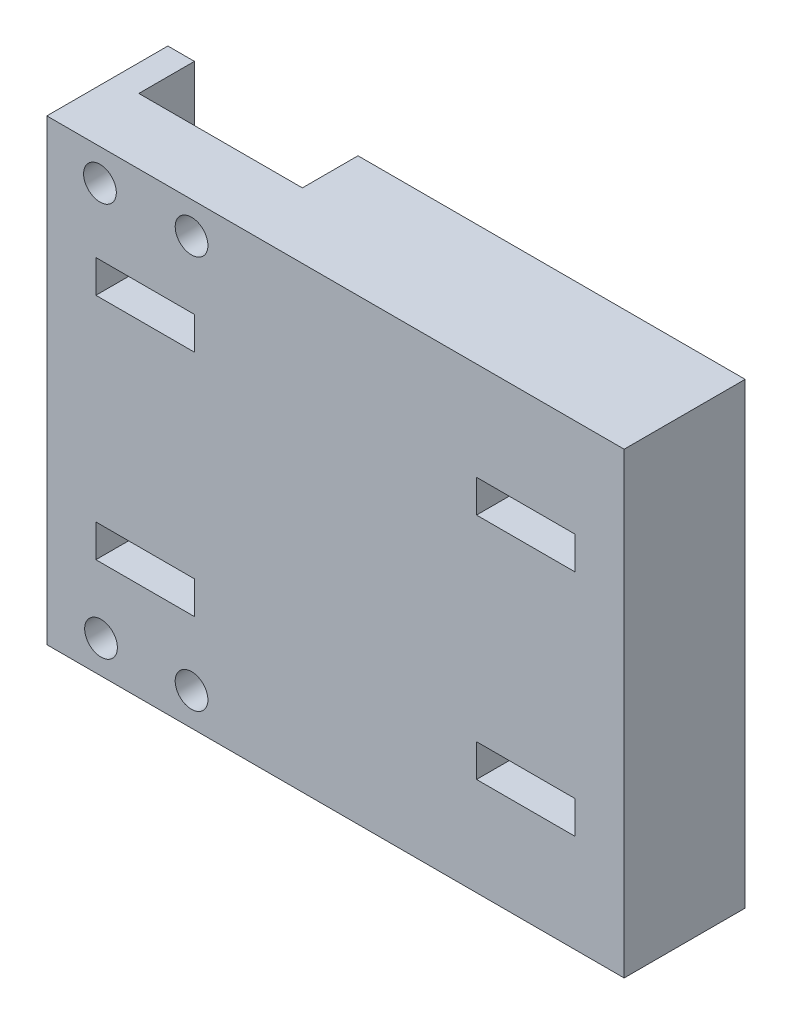
from build123d import *
from build123d.topology import SkipClean

# Parameters (mm, degrees)
SKETCH1_W                = 90
SKETCH1_H                = 70
SKETCH1_W_2              = 20.06126988
SKETCH1_H_2              = 45
SKETCH1_W_3              = 19.93873012
BOSS_EXTRUDE2_DEPTH      = 10
SKETCH1_W_4              = 15.06126988
SKETCH1_H_3              = 40
BOSS_EXTRUDE2_2_DEPTH    = 10
SKETCH1_W_5              = 14.93873012
BOSS_EXTRUDE2_3_DEPTH    = 10
SKETCH2_W                = 90
SKETCH2_H                = 70
BOSS_EXTRUDE3_DEPTH      = 10
SKETCH4_W                = 1.5
SKETCH4_H                = 70
CUT_EXTRUDE2_DEPTH       = 100.5
SKETCH10_W               = 5
SKETCH10_H               = 70
CUT_EXTRUDE4_DEPTH       = 100.5
SKETCH11_W               = 6.5
SKETCH11_H               = 5
CUT_EXTRUDE5_DEPTH       = 100.5
SKETCH12_W               = 18.5
SKETCH12_H               = 70
BOSS_EXTRUDE5_DEPTH      = 5
SKETCH13_W               = 18.5
SKETCH13_H               = 70
BOSS_EXTRUDE6_DEPTH      = 5
SKETCH14_W               = 40
SKETCH14_H               = 45
BOSS_EXTRUDE7_DEPTH      = 11
SKETCH15_R               = 2.5
CUT_EXTRUDE6_DEPTH       = 3
SKETCH16_W               = 30
SKETCH16_H               = 66
CUT_EXTRUDE8_DEPTH       = 15.5
SKETCH17_W               = 14.93873012
SKETCH17_H               = 15
SKETCH17_W_2             = 15.06126988
CUT_EXTRUDE10_DEPTH      = 10
SKETCH18_W               = 14.93873012
SKETCH18_H               = 5
SKETCH18_W_2             = 15.06126988
CUT_EXTRUDE11_DEPTH      = 10
CUT_EXTRUDE12_DEPTH      = 10
SKETCH23_W               = 14.93873012
SKETCH23_H               = 40
SKETCH23_W_2             = 5.3
SKETCH23_H_2             = 39
SKETCH23_W_3             = 2.93873012
SKETCH23_W_4             = 3.06126988
CUT_EXTRUDE14_DEPTH      = 10
SKETCH28_W               = 18.5
SKETCH28_H               = 44.033892013
CUT_EXTRUDE15_DEPTH      = 6
CUT_EXTRUDE16_DEPTH      = 75
SKETCH30_W               = 18.5
SKETCH30_H               = 44.033892013
BOSS_EXTRUDE9_DEPTH      = 6
SKETCH31_W               = 1
SKETCH31_H               = 1.413045359
BOSS_EXTRUDE10_DEPTH     = 11
SKETCH32_W               = 8.246560308
SKETCH32_H               = 43.371701703
BOSS_EXTRUDE11_DEPTH     = 5
SKETCH33_W               = 8.811569605
SKETCH33_H               = 37.919451222
BOSS_EXTRUDE12_DEPTH     = 5
SKETCH34_W               = 59.93873012
SKETCH34_H               = 70
CUT_EXTRUDE18_DEPTH      = 37
SKETCH35_W               = 14.36126988
SKETCH35_H               = 2
CUT_EXTRUDE20_DEPTH      = 7
SKETCH36_W               = 5.3
SKETCH36_H               = 2
CUT_EXTRUDE21_DEPTH      = 10
SKETCH37_W               = 14.36126988
SKETCH37_H               = 1.5
CUT_EXTRUDE22_DEPTH      = 10
SKETCH38_W               = 1.5
SKETCH38_H               = 4
CUT_EXTRUDE23_DEPTH      = 15
CUT_EXTRUDE24_DEPTH      = 10
CUT_EXTRUDE24_DEPTH_BACK = 6
SKETCH39_W               = 1.5
SKETCH39_H               = 2
CUT_EXTRUDE26_DEPTH      = 10
CUT_EXTRUDE26_DEPTH_BACK = 6
SKETCH41_W               = 16.397713906
SKETCH41_H               = 51.423830598
CUT_EXTRUDE27_DEPTH      = 5
BOSS_EXTRUDE13_DEPTH     = 14.37
FILLET4_R                = 1
BOSS_EXTRUDE14_DEPTH     = 14.37
FILLET5_R                = 1
CUT_EXTRUDE28_DEPTH      = 14.37
SKETCH45_W               = 14.36126988
SKETCH45_H               = 1
CUT_EXTRUDE29_DEPTH      = 14.37
SKETCH46_W               = 5
SKETCH46_H               = 51.423830598
BOSS_EXTRUDE15_DEPTH     = 18.37
SKETCH48_W               = 15.404975863
SKETCH48_H               = 48.247068862
CUT_EXTRUDE30_DEPTH      = 6
BOSS_EXTRUDE19_DEPTH     = 14.36
CUT_EXTRUDE33_DEPTH      = 15.36
CUT_EXTRUDE34_DEPTH      = 15.36
SKETCH56_W               = 3.76126988
SKETCH56_H               = 3.574209709
CUT_EXTRUDE35_DEPTH      = 5.36
BOSS_EXTRUDE23_DEPTH     = 14.36
CUT_EXTRUDE39_DEPTH      = 14.36
SKETCH61_W               = 0.148623377
SKETCH61_H               = 7.599329431
CUT_EXTRUDE41_DEPTH      = 10
CUT_EXTRUDE42_DEPTH      = 16
BOSS_EXTRUDE24_DEPTH     = 14.36
SKETCH68_W               = 15.06
SKETCH68_H               = 70
BOSS_EXTRUDE28_DEPTH     = 18.5
SKETCH70_W               = 6
SKETCH70_H               = 48.247068862
BOSS_EXTRUDE29_DEPTH     = 18.5
SKETCH72_W               = 16.06
SKETCH72_H               = 66
CUT_EXTRUDE44_DEPTH      = 16.5
SKETCH75_W               = 1
SKETCH75_H               = 70
CUT_EXTRUDE45_DEPTH      = 33.5
SKETCH76_R               = 2.5
CUT_EXTRUDE46_DEPTH      = 33.5
CUT_EXTRUDE48_DEPTH      = 26
CUT_EXTRUDE48_DEPTH_BACK = 23
SKETCH77_R               = 2.5
SKETCH78_W               = 22.535153564
SKETCH78_H               = 70
BOSS_EXTRUDE30_DEPTH     = 2
SKETCH79_W               = 35.12
SKETCH79_H               = 45
BOSS_EXTRUDE31_DEPTH     = 16.5
SKETCH80_W               = 6
SKETCH80_H               = 45
CUT_EXTRUDE49_DEPTH      = 16.5
SKETCH81_W               = 30.12
SKETCH81_H               = 66
BOSS_EXTRUDE33_DEPTH     = 16.5
SKETCH83_W               = 25
SKETCH83_H               = 10
CUT_EXTRUDE50_DEPTH      = 8.5
SKETCH84_R               = 2.5
CUT_EXTRUDE51_DEPTH      = 18.5


with BuildPart() as part:
    # Sketch1 → Boss-Extrude2 (new body)
    with BuildSketch(Plane.XY):
        with Locations((1.715542522, -5.667155425)):
            Rectangle(SKETCH1_W, SKETCH1_H)
        with Locations((-28.253822538, -5.667155425)):
            Rectangle(SKETCH1_W_2, SKETCH1_H_2, mode=Mode.SUBTRACT)
        with Locations((31.746177462, -5.667155425)):
            Rectangle(SKETCH1_W_3, SKETCH1_H_2, mode=Mode.SUBTRACT)
    extrude(amount=BOSS_EXTRUDE2_DEPTH)



with BuildPart() as body_2:
    # Sketch1 → Boss-Extrude2 2 (new body)
    with BuildSketch(Plane.XY):
        with Locations((-28.253822538, -5.667155425)):
            Rectangle(SKETCH1_W_4, SKETCH1_H_3)
    extrude(amount=BOSS_EXTRUDE2_2_DEPTH)


with BuildPart() as body_3:
    # Sketch1 → Boss-Extrude2 3 (new body)
    with BuildSketch(Plane.XY):
        with Locations((31.746177462, -5.667155425)):
            Rectangle(SKETCH1_W_5, SKETCH1_H_3)
    extrude(amount=BOSS_EXTRUDE2_3_DEPTH)


with BuildPart() as part_1:
    add(part.part)

    add(body_2.part)  # Boss-Extrude3 merges body 2

    add(body_3.part)  # Boss-Extrude3 merges body 3
    # Sketch2 → Boss-Extrude3 (add)
    with BuildSketch(Plane.XY.offset(10)):
        with Locations((1.715542522, -5.667155425)):
            Rectangle(SKETCH2_W, SKETCH2_H)
    extrude(amount=BOSS_EXTRUDE3_DEPTH)

    # Sketch4 → Cut-Extrude2 (cut)
    with BuildSketch(Plane.ZY.offset(43.284457478)):
        with Locations((19.25, -5.667155425)):
            Rectangle(SKETCH4_W, SKETCH4_H)
    extrude(amount=-CUT_EXTRUDE2_DEPTH, mode=Mode.SUBTRACT)

    # Sketch10 → Cut-Extrude4 (cut)
    with BuildSketch(Plane(origin=(0, 0, 0), x_dir=(-1, 0, 0), z_dir=(0, 0, -1))):
        with Locations((40.784457478, -5.667155425)):
            Rectangle(SKETCH10_W, SKETCH10_H)
        with Locations((-44.215542522, -5.667155425)):
            Rectangle(SKETCH10_W, SKETCH10_H)
    extrude(amount=-CUT_EXTRUDE4_DEPTH, mode=Mode.SUBTRACT)

    # Sketch11 → Cut-Extrude5 (cut)
    with BuildSketch(Plane.ZY.offset(35.784457478)):
        with Locations((6.75, 11.832844575)):
            Rectangle(SKETCH11_W, SKETCH11_H)
        Polygon((0, 9.332844575), (2, 14.332844575), (0, 14.332844575), align=None)
        Polygon((2, -25.667155425), (0, -20.667155425), (0, -25.667155425), align=None)
        with Locations((6.75, -23.167155425)):
            Rectangle(SKETCH11_W, SKETCH11_H)
    extrude(amount=-CUT_EXTRUDE5_DEPTH, mode=Mode.SUBTRACT)

    # Sketch12 → Boss-Extrude5 (add)
    with BuildSketch(Plane(origin=(41.715542522, 0, 0), x_dir=(0, 0, -1), z_dir=(1, 0, 0))):
        with Locations((-9.25, -5.667155425)):
            Rectangle(SKETCH12_W, SKETCH12_H)
    extrude(amount=BOSS_EXTRUDE5_DEPTH)

    # Sketch13 → Boss-Extrude6 (add)
    with BuildSketch(Plane.ZY.offset(38.284457478)):
        with Locations((9.25, -5.667155425)):
            Rectangle(SKETCH13_W, SKETCH13_H)
    extrude(amount=BOSS_EXTRUDE6_DEPTH)

    # Sketch14 → Boss-Extrude7 (add)
    with BuildSketch(Plane(origin=(0, 0, 0), x_dir=(-1, 0, 0), z_dir=(0, 0, -1))):
        with Locations((-1.776812402, -5.667155425)):
            Rectangle(SKETCH14_W, SKETCH14_H)
    extrude(amount=-BOSS_EXTRUDE7_DEPTH)

    # Sketch15 → Cut-Extrude6 (cut)
    with BuildSketch(Plane.XY.offset(18.5)):
        with Locations((8.715542522, 24.482844575)):
            Circle(SKETCH15_R)
        with Locations((-5.284457478, 24.482844575)):
            Circle(SKETCH15_R)
        with Locations((1.715542522, -35.667155425)):
            Circle(SKETCH15_R)
    extrude(amount=-CUT_EXTRUDE6_DEPTH, mode=Mode.SUBTRACT)

    # Sketch16 → Cut-Extrude8 (cut)
    with BuildSketch(Plane(origin=(0, 0, 0), x_dir=(-1, 0, 0), z_dir=(0, 0, -1))):
        with Locations((-1.776812402, -5.667155425)):
            Rectangle(SKETCH16_W, SKETCH16_H)
    extrude(amount=-CUT_EXTRUDE8_DEPTH, mode=Mode.SUBTRACT)

    # Sketch17 → Cut-Extrude10 (cut)
    with BuildSketch(Plane(origin=(0, 0, 0), x_dir=(-1, 0, 0), z_dir=(0, 0, -1))):
        with Locations((-31.746177462, -5.667155425)):
            Rectangle(SKETCH17_W, SKETCH17_H)
        with Locations((28.253822538, -5.667155425)):
            Rectangle(SKETCH17_W_2, SKETCH17_H)
    extrude(amount=-CUT_EXTRUDE10_DEPTH, mode=Mode.SUBTRACT)

    # Sketch18 → Cut-Extrude11 (cut)
    with BuildSketch(Plane(origin=(0, 0, 10), x_dir=(-1, 0, 0), z_dir=(0, 0, -1))):
        with Locations((-31.746177462, 11.832844575)):
            Rectangle(SKETCH18_W, SKETCH18_H)
        with Locations((-31.746177462, -23.167155425)):
            Rectangle(SKETCH18_W, SKETCH18_H)
        with Locations((28.253822538, -23.167155425)):
            Rectangle(SKETCH18_W_2, SKETCH18_H)
        with Locations((28.253822538, 11.832844575)):
            Rectangle(SKETCH18_W_2, SKETCH18_H)
    extrude(amount=-CUT_EXTRUDE11_DEPTH, mode=Mode.SUBTRACT)

    # Sketch19 → Cut-Extrude12 (cut)
    with BuildSketch(Plane(origin=(0, 0, 0), x_dir=(-1, 0, 0), z_dir=(0, 0, -1))):
        Polygon((-30.276812402, 14.332844575), (-33.215542522, 14.332844575), (-33.215542522, 4.832844575), (-39.215542522, 4.832844575), (-39.215542522, 1.832844575), (-24.276812402, 1.832844575), (-24.276812402, 4.832844575), (-30.276812402, 4.832844575), align=None)
        Polygon((20.723187598, 4.832844575), (20.723187598, 1.832844575), (35.784457478, 1.832844575), (35.784457478, 4.832844575), (29.784457478, 4.832844575), (29.784457478, 14.332844575), (26.723187598, 14.332844575), (26.723187598, 4.832844575), align=None)
        Polygon((20.723187598, -13.167155425), (20.723187598, -16.167155425), (26.723187598, -16.167155425), (26.723187598, -25.667155425), (29.784457478, -25.667155425), (29.784457478, -16.167155425), (35.784457478, -16.167155425), (35.784457478, -13.167155425), align=None)
        Polygon((-39.215542522, -13.167155425), (-39.215542522, -16.167155425), (-33.215542522, -16.167155425), (-33.215542522, -25.667155425), (-30.276812402, -25.667155425), (-30.276812402, -16.167155425), (-24.276812402, -16.167155425), (-24.276812402, -13.167155425), align=None)
    extrude(amount=-CUT_EXTRUDE12_DEPTH, mode=Mode.SUBTRACT)

    # Sketch23 → Cut-Extrude14 (cut)
    # profile 1 of 2: a face of its own
    with BuildSketch(Plane(origin=(0, 0, 0), x_dir=(-1, 0, 0), z_dir=(0, 0, -1))):
        with Locations((-31.746177462, -5.667155425)):
            Rectangle(SKETCH23_W, SKETCH23_H)
        with Locations((-36.215542522, -5.667155425)):
            Rectangle(SKETCH23_W_2, SKETCH23_H_2, mode=Mode.SUBTRACT)
        with Locations((-31.746177462, -5.667155425)):
            Rectangle(SKETCH23_W_3, SKETCH23_H_2, mode=Mode.SUBTRACT)
        with Locations((-27.276812402, -5.667155425)):
            Rectangle(SKETCH23_W_2, SKETCH23_H_2, mode=Mode.SUBTRACT)
    # profile 2 of 2: a face of its own
    with BuildSketch(Plane(origin=(0, 0, 0), x_dir=(-1, 0, 0), z_dir=(0, 0, -1))):
        Polygon((20.723187598, 13.832844575), (20.723187598, -25.667155425), (35.784457478, -25.667155425), (35.784457478, 14.332844575), (20.723187598, 14.332844575), align=None)
        with Locations((23.723187598, -5.667155425)):
            Rectangle(SKETCH23_W_2, SKETCH23_H_2, mode=Mode.SUBTRACT)
        with Locations((28.253822538, -5.667155425)):
            Rectangle(SKETCH23_W_4, SKETCH23_H_2, mode=Mode.SUBTRACT)
        with Locations((32.784457478, -5.667155425)):
            Rectangle(SKETCH23_W_2, SKETCH23_H_2, mode=Mode.SUBTRACT)
    extrude(amount=-CUT_EXTRUDE14_DEPTH, mode=Mode.SUBTRACT)

    # Sketch28 → Cut-Extrude15 (cut)
    with BuildSketch(Plane(origin=(46.715542522, 0, 0), x_dir=(0, 0, -1), z_dir=(1, 0, 0))):
        with Locations((-9.25, -5.184101432)):
            Rectangle(SKETCH28_W, SKETCH28_H)
    extrude(amount=-CUT_EXTRUDE15_DEPTH, mode=Mode.SUBTRACT)

    # Sketch29 → Cut-Extrude16 (cut)
    with BuildSketch(Plane(origin=(38.865542522, 0, 0), x_dir=(0, 0, -1), z_dir=(1, 0, 0))):
        Polygon((-3.5, 9.332844575), (-3.5, 7.724451309), (-5, 7.536386318), (-10, 8.528647942), (-10, 9.332844575), align=None)
        Polygon((-10, -19.862958792), (-10, -20.667155425), (-3.5, -20.667155425), (-3.5, -19.058762159), (-5, -18.870697169), align=None)
    extrude(amount=-CUT_EXTRUDE16_DEPTH, mode=Mode.SUBTRACT)

    # Sketch30 → Boss-Extrude9 (add)
    with BuildSketch(Plane(origin=(46.715542522, 0, 0), x_dir=(0, 0, -1), z_dir=(1, 0, 0))):
        with Locations((-9.25, -5.184101432)):
            Rectangle(SKETCH30_W, SKETCH30_H)
    extrude(amount=-BOSS_EXTRUDE9_DEPTH)

    # Sketch31 → Boss-Extrude10 (add)
    with BuildSketch(Plane(origin=(0, 0, 0), x_dir=(-1, 0, 0), z_dir=(0, 0, -1))):
        with Locations((-41.215542522, -27.907570118)):
            Rectangle(SKETCH31_W, SKETCH31_H)
    extrude(amount=-BOSS_EXTRUDE10_DEPTH)

    # Sketch32 → Boss-Extrude11 (add)
    with BuildSketch(Plane(origin=(21.776812402, 0, 0), x_dir=(0, 0, -1), z_dir=(1, 0, 0))):
        with Locations((-5.876719846, -6.481304574)):
            Rectangle(SKETCH32_W, SKETCH32_H)
    extrude(amount=-BOSS_EXTRUDE11_DEPTH)

    # Sketch33 → Boss-Extrude12 (add)
    with BuildSketch(Plane(origin=(-13.223187598, 0, 0), x_dir=(0, 0, -1), z_dir=(1, 0, 0))):
        with Locations((-7.016962477, -6.558213026)):
            Rectangle(SKETCH33_W, SKETCH33_H)
    extrude(amount=-BOSS_EXTRUDE12_DEPTH)

    # Sketch34 → Cut-Extrude18 (cut)
    with BuildSketch(Plane(origin=(0, 0, 0), x_dir=(-1, 0, 0), z_dir=(0, 0, -1))):
        with Locations((-16.746177462, -5.667155425)):
            Rectangle(SKETCH34_W, SKETCH34_H)
    extrude(amount=-CUT_EXTRUDE18_DEPTH, mode=Mode.SUBTRACT)

    # Sketch35 → Cut-Extrude20 (cut)
    with BuildSketch(Plane(origin=(0, 0, 0), x_dir=(-1, 0, 0), z_dir=(0, 0, -1))):
        with Locations((28.253822538, 12.832844575)):
            Rectangle(SKETCH35_W, SKETCH35_H)
    extrude(amount=-CUT_EXTRUDE20_DEPTH, mode=Mode.SUBTRACT)

    # Sketch36 → Cut-Extrude21 (cut)
    with BuildSketch(Plane(origin=(0, 0, 0), x_dir=(-1, 0, 0), z_dir=(0, 0, -1))):
        with Locations((23.723187598, 5.832844575)):
            Rectangle(SKETCH36_W, SKETCH36_H)
        with Locations((32.784457478, 5.832844575)):
            Rectangle(SKETCH36_W, SKETCH36_H)
    extrude(amount=-CUT_EXTRUDE21_DEPTH, mode=Mode.SUBTRACT)

    # Sketch37 → Cut-Extrude22 (cut)
    with BuildSketch(Plane(origin=(0, 0, 0), x_dir=(-1, 0, 0), z_dir=(0, 0, -1))):
        with Locations((28.253822538, -16.917155425)):
            Rectangle(SKETCH37_W, SKETCH37_H)
    extrude(amount=-CUT_EXTRUDE22_DEPTH, mode=Mode.SUBTRACT)

    # Sketch38 → Cut-Extrude23 (cut)
    with BuildSketch(Plane(origin=(-21.073187598, 0, 0), x_dir=(0, 0, -1), z_dir=(1, 0, 0))):
        with Locations((-2.75, 9.832844575)):
            Rectangle(SKETCH38_W, SKETCH38_H)
    extrude(amount=-CUT_EXTRUDE23_DEPTH, mode=Mode.SUBTRACT)

    # Sketch39 → Cut-Extrude24 (cut, two sides: drawn at the far end of the back side and taken through both)
    with BuildSketch(Plane(origin=(-30.134457478, 0, 0), x_dir=(0, 0, -1), z_dir=(1, 0, 0)).offset(-CUT_EXTRUDE24_DEPTH_BACK)):
        with Locations((-2.75, -20.058762159)):
            Rectangle(SKETCH39_W, SKETCH39_H)
    extrude(amount=CUT_EXTRUDE24_DEPTH + CUT_EXTRUDE24_DEPTH_BACK, mode=Mode.SUBTRACT)

    # Sketch40 → Cut-Extrude26 (cut, two sides: drawn at the far end of the back side and taken through both)
    with BuildSketch(Plane.ZY.offset(26.373187598).offset(-CUT_EXTRUDE26_DEPTH_BACK)):
        Polygon((2, -21.058762159), (3.5, -22.496291026), (3.5, -21.058762159), align=None)
    extrude(amount=CUT_EXTRUDE26_DEPTH + CUT_EXTRUDE26_DEPTH_BACK, mode=Mode.SUBTRACT)

    # Sketch41 → Cut-Extrude27 (cut)
    with BuildSketch(Plane.ZY.offset(43.284457478)):
        with Locations((8.198856953, -6.213161349)):
            Rectangle(SKETCH41_W, SKETCH41_H)
    extrude(amount=-CUT_EXTRUDE27_DEPTH, mode=Mode.SUBTRACT)

    # Sketch42 → Boss-Extrude13 (add)
    with BuildSketch(Plane.ZY.offset(35.434457478)):
        Polygon((10, 8.528647942), (2, 7.832844575), (2, 6.832844575), (10, 6.832844575), align=None)
    extrude(amount=-BOSS_EXTRUDE13_DEPTH)

    # Fillet4
    fillet4_edges = [part_1.edges().sort_by_distance(p)[0] for p in [
        (-23.723187598, 7.832844575, 2),
        (-32.784457478, 7.832844575, 2),
    ]]
    fillet(fillet4_edges, radius=FILLET4_R)

    # Sketch43 → Boss-Extrude14 (add)
    with BuildSketch(Plane.ZY.offset(35.434457478)):
        Polygon((10, -17.667155425), (10, -19.862958792), (2, -19.058762159), (2, -17.667155425), align=None)
    extrude(amount=-BOSS_EXTRUDE14_DEPTH)

    # Fillet5
    fillet5_edges = [part_1.edges().sort_by_distance(p)[0] for p in [
        (-23.723187598, -19.058762159, 2),
        (-32.784457478, -19.058762159, 2),
    ]]
    fillet(fillet5_edges, radius=FILLET5_R)

    # Sketch44 → Cut-Extrude28 (cut)
    with BuildSketch(Plane.ZY.offset(35.434457478)):
        Polygon((3.5, -25.167155425), (2.65, -25.167155425), (2.75, -21.777526593), (3.5, -22.496291026), align=None)
    extrude(amount=-CUT_EXTRUDE28_DEPTH, mode=Mode.SUBTRACT)

    # Sketch45 → Cut-Extrude29 (cut)
    with BuildSketch(Plane(origin=(0, 0, 0), x_dir=(-1, 0, 0), z_dir=(0, 0, -1))):
        with Locations((28.253822538, -24.667155425)):
            Rectangle(SKETCH45_W, SKETCH45_H)
    extrude(amount=-CUT_EXTRUDE29_DEPTH, mode=Mode.SUBTRACT)

    # Sketch46 → Boss-Extrude15 (add)
    with BuildSketch(Plane(origin=(0, 0, 0), x_dir=(-1, 0, 0), z_dir=(0, 0, -1))):
        with Locations((40.784457478, -6.213161349)):
            Rectangle(SKETCH46_W, SKETCH46_H)
    extrude(amount=-BOSS_EXTRUDE15_DEPTH)

    # Sketch48 → Cut-Extrude30 (cut)
    with BuildSketch(Plane.ZY.offset(43.284457478)):
        with Locations((7.702487932, -6.312435153)):
            Rectangle(SKETCH48_W, SKETCH48_H)
    extrude(amount=-CUT_EXTRUDE30_DEPTH, mode=Mode.SUBTRACT)

    # Sketch52 → Boss-Extrude19 (add)
    with BuildSketch(Plane.ZY.offset(35.434457478)):
        with BuildLine():
            Line((10, 8.528647942), (3.782211541, 7.987853174))
            ThreePointArc((3.782211541, 7.987853174), (2.993551961, 8.279394923), (2.717099882, 9.073469714))
            Line((2.717099882, 9.073469714), (2.717099882, 11.832427917))
            Line((2.717099882, 11.832427917), (1.5, 11.832844575))
            Line((1.5, 11.832844575), (0, 8.279394923))
            Line((0, 8.279394923), (0, 5.979658876))
            Line((0, 5.979658876), (10, 5.979658876))
            Line((10, 5.979658876), (10, 8.528647942))
        make_face()
    extrude(amount=-BOSS_EXTRUDE19_DEPTH)

    # Sketch53 → Cut-Extrude33 (cut)
    with BuildSketch(Plane.ZY.offset(35.434457478)):
        Polygon((0, 9.332844575), (0.5, 9.332844575), (1.5, 11.832844575), (1, 11.832844575), align=None)
    extrude(amount=-CUT_EXTRUDE33_DEPTH, mode=Mode.SUBTRACT)

    # Sketch55 → Cut-Extrude34 (cut)
    with BuildSketch(Plane.ZY.offset(35.434457478)):
        Polygon((0.5, 9.332844575), (0, 8.258634866), (0, 9.332844575), align=None)
    extrude(amount=-CUT_EXTRUDE34_DEPTH, mode=Mode.SUBTRACT)

    # Sketch56 → Cut-Extrude35 (cut)
    with BuildSketch(Plane(origin=(0, 0, 0), x_dir=(-1, 0, 0), z_dir=(0, 0, -1))):
        with Locations((28.253822538, 10.045739721)):
            Rectangle(SKETCH56_W, SKETCH56_H)
    extrude(amount=-CUT_EXTRUDE35_DEPTH, mode=Mode.SUBTRACT)

    # Sketch58 → Boss-Extrude23 (add)
    with BuildSketch(Plane.ZY.offset(35.434457478)):
        Polygon((1.5, 11.832844575), (2.146438787, 13.448941543), (2.736734348, 13.448941543), (2.717099882, 11.832427917), align=None)
    extrude(amount=-BOSS_EXTRUDE23_DEPTH)

    # Sketch59 → Cut-Extrude39 (cut)
    with BuildSketch(Plane(origin=(0, 0, 0), x_dir=(-1, 0, 0), z_dir=(0, 0, -1))):
        Polygon((26.373187598, 13.448941543), (26.373187598, 11.832844575), (26.373187598, 11.431091881), (30.134457478, 11.431091881), (30.134457478, 11.832844575), (30.134457478, 13.448941543), (30.134457478, 13.829263242), (26.373187598, 13.829263242), align=None)
    extrude(amount=-CUT_EXTRUDE39_DEPTH, mode=Mode.SUBTRACT)

    # Sketch61 → Cut-Extrude41 (cut)
    with BuildSketch(Plane(origin=(0, 0, 0), x_dir=(-1, 0, 0), z_dir=(0, 0, -1))):
        with Locations((21.00014579, 9.779323592)):
            Rectangle(SKETCH61_W, SKETCH61_H)
    extrude(amount=-CUT_EXTRUDE41_DEPTH, mode=Mode.SUBTRACT)

    # Sketch62 → Cut-Extrude42 (cut)
    with BuildSketch(Plane.ZY.offset(35.434457478)):
        Polygon((10, -17.667155425), (0, -17.667155425), (0, -20.667155425), (1.4, -24.167155425), (2.679501755, -24.167155425), (2.75, -21.777526593), (10, -19.862958792), align=None)
    extrude(amount=-CUT_EXTRUDE42_DEPTH, mode=Mode.SUBTRACT)

    # Sketch65 → Boss-Extrude24 (add)
    with BuildSketch(Plane.ZY.offset(35.434457478)):
        with BuildLine():
            Line((0, 8.258634866), (0, 5.979658876))
            Line((0, 5.979658876), (10, 5.979658876))
            Line((10, 5.979658876), (10, 8.528647942))
            Line((10, 8.528647942), (3.782211541, 7.987853174))
            ThreePointArc((3.782211541, 7.987853174), (3.026420054, 8.311642211), (2.717099882, 9.073469714))
            Line((2.717099882, 9.073469714), (2.736734348, 13.448941543))
            Line((2.736734348, 13.448941543), (2.146438787, 13.448941543))
            Line((2.146438787, 13.448941543), (0.5, 9.332844575))
            Line((0.5, 9.332844575), (0, 8.258634866))
        make_face()
        with BuildLine():
            Line((10, -17.313969726), (10, -19.862958792))
            Line((10, -19.862958792), (3.782211541, -19.322164024))
            ThreePointArc((3.782211541, -19.322164024), (3.026420054, -19.645953062), (2.717099882, -20.407780564))
            Line((2.717099882, -20.407780564), (2.736734348, -24.783252393))
            Line((2.736734348, -24.783252393), (2.146438787, -24.783252393))
            Line((2.146438787, -24.783252393), (0.5, -20.667155425))
            Line((0.5, -20.667155425), (0, -19.592945716))
            Line((0, -19.592945716), (0, -17.313969726))
            Line((0, -17.313969726), (10, -17.313969726))
        make_face()
    extrude(amount=-BOSS_EXTRUDE24_DEPTH)

    # Sketch68 → Boss-Extrude28 (add)
    with BuildSketch(Plane(origin=(0, 0, 0), x_dir=(-1, 0, 0), z_dir=(0, 0, -1))):
        with Locations((50.814457478, -5.667155425)):
            Rectangle(SKETCH68_W, SKETCH68_H)
    extrude(amount=-BOSS_EXTRUDE28_DEPTH)

    # Sketch70 → Boss-Extrude29 (add)
    with BuildSketch(Plane(origin=(0, 0, 0), x_dir=(-1, 0, 0), z_dir=(0, 0, -1))):
        with Locations((40.284457478, -6.312435153)):
            Rectangle(SKETCH70_W, SKETCH70_H)
    extrude(amount=-BOSS_EXTRUDE29_DEPTH)

    # Sketch72 → Cut-Extrude44 (cut)
    with BuildSketch(Plane(origin=(0, 0, 0), x_dir=(-1, 0, 0), z_dir=(0, 0, -1))):
        with Locations((50.314457478, -5.667155425)):
            Rectangle(SKETCH72_W, SKETCH72_H)
    extrude(amount=-CUT_EXTRUDE44_DEPTH, mode=Mode.SUBTRACT)

    # Sketch75 → Cut-Extrude45 (cut)
    with BuildSketch(Plane(origin=(0, 0, 0), x_dir=(-1, 0, 0), z_dir=(0, 0, -1))):
        with Locations((57.844457478, -5.667155425)):
            Rectangle(SKETCH75_W, SKETCH75_H)
    extrude(amount=-CUT_EXTRUDE45_DEPTH, mode=Mode.SUBTRACT)

    # Sketch76 → Cut-Extrude46 (cut)
    with BuildSketch(Plane(origin=(0, 0, 16.5), x_dir=(-1, 0, 0), z_dir=(0, 0, -1))):
        with Locations((50.344457478, 24.482844575)):
            Circle(SKETCH76_R)
        with Locations((57.344457478, -35.667155425)):
            Circle(SKETCH76_R)
    extrude(amount=-CUT_EXTRUDE46_DEPTH, mode=Mode.SUBTRACT)

    # Mirror15: part across plane


with BuildPart() as part_2:
    with SkipClean():  # the faces are left unmerged after this step: merging them gives an invalid solid
        add(part_1.part)
        add(part_1.part.mirror(Plane(origin=(-57.344457478, -40.667155425, 33.5), x_dir=(0, 0, 1), z_dir=(1, 0, 0))))

    # Sketch77 → Cut-Extrude48 (cut, two sides: drawn at the far end of the back side and taken through both)
    with SkipClean():  # the faces are left unmerged after this step: merging them gives an invalid solid
        with BuildSketch(Plane(origin=(0, 0, 16.5), x_dir=(-1, 0, 0), z_dir=(0, 0, -1)).offset(-CUT_EXTRUDE48_DEPTH_BACK)):
            with Locations((79.344457478, 24.482844575)):
                Circle(SKETCH77_R)
            with Locations((93.344457478, 24.482844575)):
                Circle(SKETCH77_R)
            with Locations((93.18230081, -35.667155425)):
                Circle(SKETCH77_R)
        extrude(amount=CUT_EXTRUDE48_DEPTH + CUT_EXTRUDE48_DEPTH_BACK, mode=Mode.SUBTRACT)

    # Sketch78 → Boss-Extrude30 (add)
    with BuildSketch(Plane.XY.offset(18.5)):
        with Locations((-56.897725359, -5.667155425)):
            Rectangle(SKETCH78_W, SKETCH78_H)
    extrude(amount=-BOSS_EXTRUDE30_DEPTH)

    # Sketch79 → Boss-Extrude31 (add)
    with BuildSketch(Plane(origin=(0, 0, 16.5), x_dir=(-1, 0, 0), z_dir=(0, 0, -1))):
        with Locations((59.844457478, -5.667155425)):
            Rectangle(SKETCH79_W, SKETCH79_H)
    extrude(amount=BOSS_EXTRUDE31_DEPTH)

    # Sketch80 → Cut-Extrude49 (cut)
    with BuildSketch(Plane(origin=(0, 0, 0), x_dir=(-1, 0, 0), z_dir=(0, 0, -1))):
        with Locations((45.284457478, -5.667155425)):
            Rectangle(SKETCH80_W, SKETCH80_H)
        with Locations((69.404457478, -5.667155425)):
            Rectangle(SKETCH80_W, SKETCH80_H)
    extrude(amount=-CUT_EXTRUDE49_DEPTH, mode=Mode.SUBTRACT)

    # Sketch81 → Boss-Extrude33 (add)
    with BuildSketch(Plane(origin=(0, 0, 16.5), x_dir=(-1, 0, 0), z_dir=(0, 0, -1))):
        with Locations((57.344457478, -5.667155425)):
            Rectangle(SKETCH81_W, SKETCH81_H)
    extrude(amount=BOSS_EXTRUDE33_DEPTH)

    # Sketch83 → Cut-Extrude50 (cut)
    with BuildSketch(Plane(origin=(0, 0, 0), x_dir=(-1, 0, 0), z_dir=(0, 0, -1))):
        with Locations((84.904457478, 24.332844575)):
            Rectangle(SKETCH83_W, SKETCH83_H)
        with Locations((84.904457478, -35.667155425)):
            Rectangle(SKETCH83_W, SKETCH83_H)
    extrude(amount=-CUT_EXTRUDE50_DEPTH, mode=Mode.SUBTRACT)

    # Sketch84 → Cut-Extrude51 (cut)
    with BuildSketch(Plane.XY.offset(18.5)):
        with Locations((-79.344457478, -35.667155425)):
            Circle(SKETCH84_R)
    extrude(amount=-CUT_EXTRUDE51_DEPTH, mode=Mode.SUBTRACT)


solid = part_2.part
